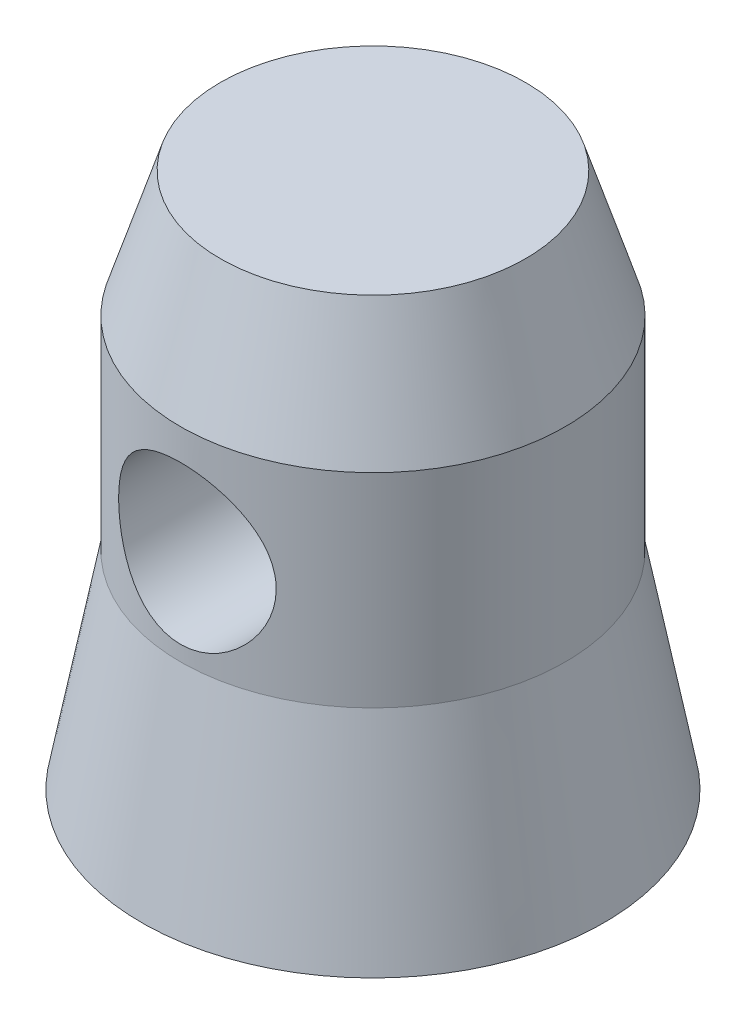
from build123d import *

# Parameters (mm, degrees)
CUT_EXTRUDE1_DEPTH         = 47.945551288
CUT_EXTRUDE1_DEPTH_BACK    = 47.945551288
SKETCH2_R                  = 5.8928
M10X1_5_TAPPED_HOLE1_D     = 8.5
M10X1_5_TAPPED_HOLE1_DEPTH = 9.2456
M10X1_5_TAPPED_HOLE1_TIP   = 2.553657631


with BuildPart() as part:
    # Sketch1 → Revolve1 (revolve)
    with BuildSketch(Plane.XY):
        Polygon((0, 40.0685), (0, 3.31), (5, 3.31), (10.5974, 0), (17.2974, 0), (14.3891, 15.432044722), (14.3891, 30.672044722), (11.4173, 40.0685), align=None)
    revolve(axis=Axis((0, 40.0685, 0), (0, -1, 0)))

    # Sketch2 → Cut-Extrude1 (cut, two sides: drawn at the far end of the back side and taken through both)
    with BuildSketch(Plane.XY.offset(-CUT_EXTRUDE1_DEPTH_BACK)):
        with Locations((0, 22.4663)):
            Circle(SKETCH2_R)
    extrude(amount=CUT_EXTRUDE1_DEPTH + CUT_EXTRUDE1_DEPTH_BACK, mode=Mode.SUBTRACT)

    # M10x1.5 Tapped Hole1
    with Locations(Plane(origin=(0, 3.31, 0), x_dir=(-1, 0, 0), z_dir=(0, -1, 0))):
        with Locations((0, 0)):
            Hole(M10X1_5_TAPPED_HOLE1_D / 2, depth=M10X1_5_TAPPED_HOLE1_DEPTH)
            with Locations((0, 0, -(M10X1_5_TAPPED_HOLE1_DEPTH + M10X1_5_TAPPED_HOLE1_TIP / 2))):  # 118° drill point
                Cone(0, M10X1_5_TAPPED_HOLE1_D / 2, M10X1_5_TAPPED_HOLE1_TIP, mode=Mode.SUBTRACT)


solid = part.part
